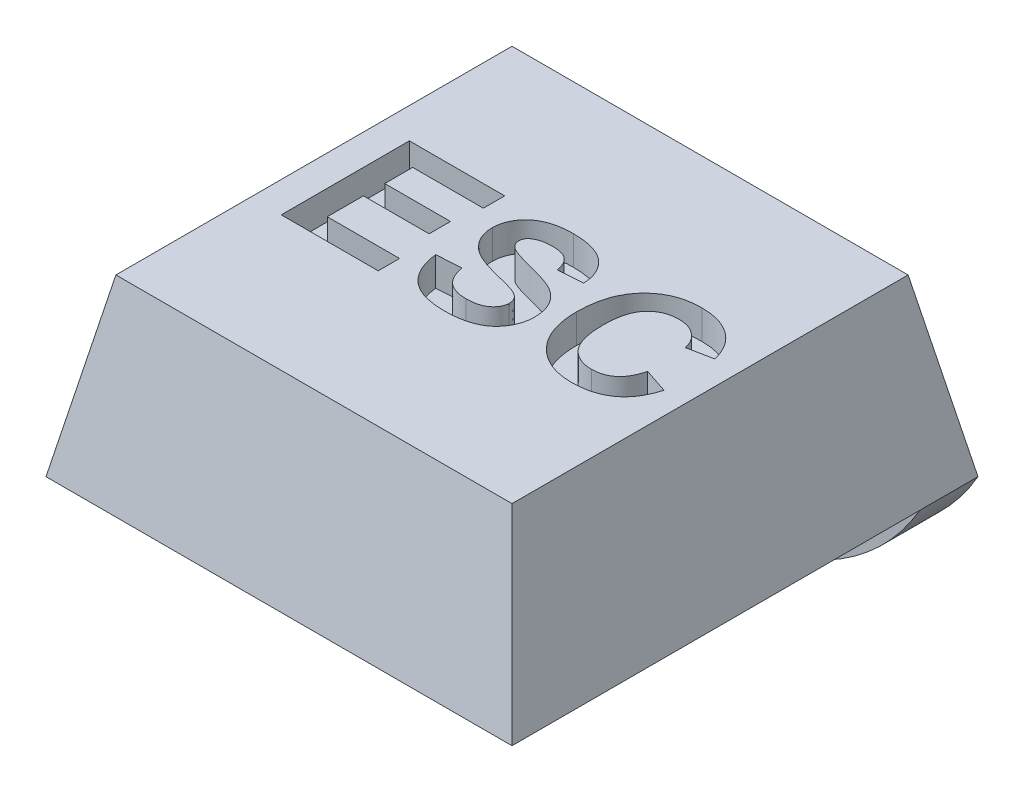
from build123d import *

# Parameters (mm, degrees)
SKETCH1_W               = 8
SKETCH1_H               = 8
BOSS_EXTRUDE1_DEPTH     = 3
CUT_EXTRUDE1_DEPTH      = 12.704699911
CUT_EXTRUDE1_DEPTH_BACK = 12.704699911
CUT_EXTRUDE2_DEPTH      = 11
SKETCH4_R               = 1.75
CUT_EXTRUDE3_DEPTH      = 0.4
SKETCH5_W               = 8
SKETCH5_H               = 1
BOSS_EXTRUDE2_DEPTH     = 2
FILLET1_R               = 4
CUT_EXTRUDE4_DEPTH      = 0.5


with BuildPart() as part:
    # Sketch1 → Boss-Extrude1 (new body)
    with BuildSketch(Plane(origin=(0, 0, 0), x_dir=(1, 0, 0), z_dir=(0, 1, 0))):
        with Locations((4, 4)):
            Rectangle(SKETCH1_W, SKETCH1_H)
    extrude(amount=BOSS_EXTRUDE1_DEPTH)

    # Sketch2 → Cut-Extrude1 (cut, two sides: drawn at the far end of the back side and taken through both)
    with BuildSketch(Plane.XY.offset(-CUT_EXTRUDE1_DEPTH_BACK)):
        Polygon((0, 0), (0.6, 3), (0, 3), align=None)
        Polygon((8, 0), (7.4, 3), (8, 3), align=None)
    extrude(amount=CUT_EXTRUDE1_DEPTH + CUT_EXTRUDE1_DEPTH_BACK, mode=Mode.SUBTRACT)

    # Sketch3 → Cut-Extrude2 (cut)
    with BuildSketch(Plane(origin=(0, 0, 0), x_dir=(0, 0, -1), z_dir=(1, 0, 0))):
        Polygon((0, 0), (0.6, 3), (0, 3), align=None)
        Polygon((8, 3), (7.4, 3), (8, 0), align=None)
    extrude(amount=CUT_EXTRUDE2_DEPTH, mode=Mode.SUBTRACT)

    # Sketch4 → Cut-Extrude3 (cut)
    with BuildSketch(Plane.XZ):
        with Locations(Location((4, -3.75, 0), (0, 0, 270))):
            Circle(SKETCH4_R)
    extrude(amount=-CUT_EXTRUDE3_DEPTH, mode=Mode.SUBTRACT)

    # Sketch5 → Boss-Extrude2 (add)
    with BuildSketch(Plane.XZ):
        with Locations((4, -7.5)):
            Rectangle(SKETCH5_W, SKETCH5_H)
    extrude(amount=BOSS_EXTRUDE2_DEPTH)

    # Fillet1
    # the kernel refuses this fillet: 4 mm, written as the material it takes off along each edge
    with BuildSketch(Plane(origin=(8, -2, -16.660254038), x_dir=(0, 1, 0), z_dir=(0, 0, 1)), Plane(origin=(0, -2, 1.660254038), x_dir=(0, 1, 0), z_dir=(0, 0, -1))) as fillet1_piece_1:
        with BuildLine():
            CenterArc((4, 3.464101615), FILLET1_R, 180, 60)
            Line((0, 3.464101615), (-0.08, 3.464101615))
            Line((-0.08, 3.464101615), (-0.08, 0))
            Line((-0.08, 0), (0, -0.08))
            ThreePointArc((0, -0.08), (1, -0.08), (1.96, -0.069282032))
            Line((1.96, -0.069282032), (2, 0))
        make_face()
    extrude(amount=18.320508076, mode=Mode.SUBTRACT)

    # Sketch6 → Cut-Extrude4 (cut)
    with BuildSketch(Plane(origin=(0, 3, 0), x_dir=(1, 0, 0), z_dir=(0, 1, 0))):
        Polygon((1.125870015, 2.912739384), (1.125870015, 5.112739384), (2.761767451, 5.112739384), (2.761767451, 4.746072718), (1.548946938, 4.746072718), (1.548946938, 4.266585538), (2.677152067, 4.266585538), (2.677152067, 3.899918872), (1.548946938, 3.899918872), (1.548946938, 3.279406051), (2.789972579, 3.279406051), (2.789972579, 2.912739384), align=None)
        with BuildLine():
            Line((3.043818733, 3.646072718), (3.466895656, 3.674277846))
            add(Edge.make_bspline(
                [(3.466895656, 3.674277846), (3.47026619, 3.656577797), (3.476813238, 3.622196579), (3.49135955, 3.573198648), (3.507371013, 3.527518681), (3.526505589, 3.485646517), (3.547453062, 3.446808174), (3.571934275, 3.412110062), (3.598241356, 3.380444359), (3.627676557, 3.352948362), (3.659745827, 3.328866988), (3.694609187, 3.30832959), (3.731888865, 3.290554101), (3.771676011, 3.275916549), (3.814380695, 3.264989545), (3.859630895, 3.25721563), (3.907491509, 3.252237429), (3.940200428, 3.251552081), (3.956959759, 3.251200923)],
                knots=[0, 0, 0, 0, 1.204560339, 2.339781841, 3.415289417, 4.440034832, 5.416475564, 6.362424008, 7.275913008, 8.16578645, 9.05021719, 9.95355393, 10.867835453, 11.809845306, 12.784702352, 13.812224031, 14.87903166, 16, 16, 16, 16], degree=3))
            add(Edge.make_bspline(
                [(3.956959759, 3.251200923), (3.974600015, 3.251393377), (4.008911222, 3.25176771), (4.058631954, 3.256411641), (4.105123098, 3.263064572), (4.147974119, 3.273596006), (4.187985219, 3.285373748), (4.22416269, 3.301486955), (4.257091969, 3.320071209), (4.286688222, 3.341159522), (4.3125169, 3.364547974), (4.335113116, 3.38896476), (4.354792928, 3.413882364), (4.370282333, 3.440406521), (4.3828177, 3.467464485), (4.3911027, 3.49586344), (4.396699709, 3.524951286), (4.397341522, 3.544830846), (4.397664887, 3.554846756)],
                knots=[0, 0, 0, 0, 1.417779877, 2.757654889, 4.012140507, 5.189587551, 6.302846416, 7.360586765, 8.365575446, 9.33904572, 10.275781718, 11.161696098, 12.012180333, 12.822428111, 13.625933072, 14.403138519, 15.195454004, 16, 16, 16, 16], degree=3))
            add(Edge.make_bspline(
                [(4.397664887, 3.554846756), (4.397268308, 3.567395879), (4.396492458, 3.591946401), (4.387152008, 3.627044061), (4.373144499, 3.659561029), (4.35205403, 3.689017029), (4.323703249, 3.71593552), (4.287539002, 3.741117109), (4.242551822, 3.763770691), (4.209177186, 3.776406901), (4.191414887, 3.783132013)],
                knots=[0, 0, 0, 0, 0.90494901, 1.770400303, 2.607161909, 3.452839393, 4.36912122, 5.420987164, 6.627424851, 8, 8, 8, 8], degree=3))
            add(Edge.make_bspline(
                [(4.191414887, 3.783132013), (4.183793555, 3.785685956), (4.166738252, 3.791401267), (4.137643715, 3.799573623), (4.102598573, 3.809778723), (4.061096401, 3.821378449), (4.013151153, 3.833241916), (3.959298316, 3.84785636), (3.898881364, 3.862398927), (3.856613592, 3.873134246), (3.834443733, 3.878765025)],
                knots=[0, 0, 0, 0, 0.521821638, 1.167752076, 1.961721917, 2.891982557, 3.96540661, 5.168436773, 6.514817513, 8, 8, 8, 8], degree=3))
            add(Edge.make_bspline(
                [(3.834443733, 3.878765025), (3.805571998, 3.885973624), (3.749868706, 3.899881436), (3.670423056, 3.924622448), (3.59725216, 3.949204014), (3.531060534, 3.975876331), (3.471118057, 4.002831746), (3.418394318, 4.031962707), (3.371789087, 4.06175634), (3.344631137, 4.084024829), (3.331599182, 4.094710538)],
                knots=[0, 0, 0, 0, 1.293880989, 2.496331788, 3.617634808, 4.64976062, 5.598842568, 6.473791081, 7.267636666, 8, 8, 8, 8], degree=3))
            add(Edge.make_bspline(
                [(3.331599182, 4.094710538), (3.315437863, 4.109842312), (3.283752103, 4.139509552), (3.242042718, 4.188258523), (3.206995477, 4.23975401), (3.178147761, 4.293615909), (3.155935566, 4.3501543), (3.140191847, 4.40899074), (3.13000194, 4.470278784), (3.12896213, 4.512017394), (3.128434118, 4.533212141)],
                knots=[0, 0, 0, 0, 1.064429417, 2.086912298, 3.078678339, 4.055528992, 5.020032834, 5.993708893, 6.981211098, 8, 8, 8, 8], degree=3))
            add(Edge.make_bspline(
                [(3.128434118, 4.533212141), (3.129462426, 4.560637891), (3.131502283, 4.615042392), (3.150209101, 4.695009582), (3.179349212, 4.772171761), (3.213144831, 4.833441389), (3.245615129, 4.879792095), (3.272579348, 4.913052937), (3.302202148, 4.944181887), (3.334889297, 4.972419613), (3.369427042, 4.999420158), (3.407153508, 5.023396966), (3.446999034, 5.045981793), (3.50466005, 5.072755055), (3.582947888, 5.100655423), (3.684804571, 5.124173662), (3.79570633, 5.138311162), (3.87259486, 5.140045534), (3.912448541, 5.140944513)],
                knots=[0, 0, 0, 0, 1.180131776, 2.341029169, 3.518901375, 4.725685298, 5.343762192, 5.955650671, 6.568945152, 7.192346361, 7.815201106, 8.455999361, 9.116257477, 9.787318263, 11.192748436, 12.688084276, 14.283332633, 16, 16, 16, 16], degree=3))
            add(Edge.make_bspline(
                [(3.912448541, 5.140944513), (3.945080768, 5.140508138), (4.008549753, 5.139659398), (4.100555419, 5.13107681), (4.186493702, 5.117719026), (4.266063037, 5.098543989), (4.339300495, 5.073208732), (4.406489968, 5.043029652), (4.467574359, 5.00719951), (4.521810028, 4.965512691), (4.570128811, 4.919555646), (4.612279221, 4.869357216), (4.648422408, 4.815551374), (4.678791636, 4.758177443), (4.702640511, 4.696940436), (4.720156568, 4.631916765), (4.73174184, 4.563259479), (4.734645724, 4.516214821), (4.736126426, 4.492226564)],
                knots=[0, 0, 0, 0, 1.325124071, 2.577337985, 3.749592149, 4.855247722, 5.896868755, 6.892903601, 7.842551483, 8.766257401, 9.665194363, 10.546067736, 11.423174165, 12.293291263, 13.177512979, 14.086532529, 15.024315359, 16, 16, 16, 16], degree=3))
            Line((4.736126426, 4.492226564), (4.313049502, 4.464021436))
            add(Edge.make_bspline(
                [(4.313049502, 4.464021436), (4.310608879, 4.477287993), (4.305852356, 4.503143134), (4.295510374, 4.540172949), (4.283845121, 4.574421305), (4.270191546, 4.60588798), (4.253699677, 4.634009379), (4.235751784, 4.659670214), (4.215852767, 4.682528569), (4.193343761, 4.701958509), (4.168998272, 4.719638959), (4.141252995, 4.733810248), (4.111270487, 4.746958085), (4.077910097, 4.756842035), (4.041812463, 4.764682339), (4.00295656, 4.77049463), (3.961261846, 4.773332518), (3.932577419, 4.773955523), (3.917737002, 4.774277846)],
                knots=[0, 0, 0, 0, 1.151066407, 2.24330871, 3.278475654, 4.238599069, 5.165719782, 6.056502506, 6.909492653, 7.744782051, 8.590364415, 9.471203867, 10.39832458, 11.382154319, 12.435022857, 13.550631277, 14.73277401, 16, 16, 16, 16], degree=3))
            add(Edge.make_bspline(
                [(3.917737002, 4.774277846), (3.902307022, 4.773993288), (3.872287307, 4.773439667), (3.82854058, 4.770042179), (3.787502868, 4.763770743), (3.748972622, 4.755606889), (3.713001312, 4.74450053), (3.679664846, 4.730958145), (3.648810708, 4.715014589), (3.6299972, 4.702470749), (3.620701746, 4.696273038)],
                knots=[0, 0, 0, 0, 1.186678824, 2.308736671, 3.37120409, 4.377216403, 5.334874112, 6.262130804, 7.141346615, 8, 8, 8, 8], degree=3))
            add(Edge.make_bspline(
                [(3.620701746, 4.696273038), (3.61006388, 4.687806789), (3.589461635, 4.671410293), (3.567289261, 4.638852427), (3.55394144, 4.602079293), (3.552334878, 4.576074512), (3.551511041, 4.562739384)],
                knots=[0, 0, 0, 0, 1.037857257, 2.010007357, 2.979541333, 4, 4, 4, 4], degree=3))
            add(Edge.make_bspline(
                [(3.551511041, 4.562739384), (3.55218479, 4.550276823), (3.553511967, 4.52572756), (3.56689826, 4.4908548), (3.587484556, 4.45854268), (3.606719073, 4.440990313), (3.6167354, 4.431849961)],
                knots=[0, 0, 0, 0, 0.98538058, 1.941042925, 2.927803204, 4, 4, 4, 4], degree=3))
            add(Edge.make_bspline(
                [(3.6167354, 4.431849961), (3.624684646, 4.425917415), (3.642447902, 4.412660642), (3.674986667, 4.395810029), (3.714261809, 4.377559798), (3.761168708, 4.359718182), (3.815395621, 4.341909685), (3.876945847, 4.323315555), (3.94585724, 4.304471782), (4.020373284, 4.28622251), (4.096028056, 4.268284525), (4.16822332, 4.248673243), (4.235354533, 4.229553761), (4.297110428, 4.209513441), (4.353809344, 4.190004251), (4.405175858, 4.169966908), (4.451562673, 4.150452778), (4.505654841, 4.123619468), (4.566962873, 4.087272664), (4.631220607, 4.034436522), (4.688048373, 3.975045249), (4.727644451, 3.919043375), (4.754844884, 3.870880273), (4.772359092, 3.832488672), (4.787510257, 3.792033606), (4.799843264, 3.749470368), (4.808781726, 3.704739066), (4.816178824, 3.658181449), (4.819958138, 3.609410844), (4.820477775, 3.576152762), (4.82074181, 3.559253808)],
                knots=[0, 0, 0, 0, 0.511875881, 1.143829537, 1.88775736, 2.750598373, 3.734912702, 4.837306479, 6.073130119, 7.42648979, 8.801963576, 10.091065733, 11.292408984, 12.408830014, 13.446061236, 14.39066453, 15.257936293, 16.045629259, 17.510392066, 18.929669597, 20.331293837, 21.746891395, 22.460690638, 23.187651344, 23.925159671, 24.69163991, 25.474819891, 26.281170188, 27.126635539, 28, 28, 28, 28], degree=3))
            add(Edge.make_bspline(
                [(4.82074181, 3.559253808), (4.820378753, 3.543669193), (4.819657756, 3.512719659), (4.814619235, 3.466782737), (4.806827289, 3.42166157), (4.795292532, 3.377299593), (4.7799905, 3.333784076), (4.762761628, 3.290486968), (4.741217893, 3.248352489), (4.716698184, 3.207345741), (4.689651831, 3.167497498), (4.65900329, 3.130738401), (4.626552736, 3.095842079), (4.590226664, 3.06476253), (4.552268292, 3.034983227), (4.510941443, 3.008610176), (4.467214345, 2.984744899), (4.420810518, 2.963565576), (4.371565435, 2.94510971), (4.319543056, 2.928682706), (4.264274691, 2.915238465), (4.206221198, 2.903715057), (4.145170128, 2.894951803), (4.081197808, 2.888833014), (4.014289695, 2.885382386), (3.968715741, 2.884820479), (3.945501426, 2.884534256)],
                knots=[0, 0, 0, 0, 0.900570041, 1.788444861, 2.667795364, 3.545012114, 4.433698372, 5.332345486, 6.235991676, 7.164928091, 8.092777575, 9.015680987, 9.928493428, 10.842962589, 11.775229507, 12.714851019, 13.672254427, 14.652424454, 15.660007982, 16.709910502, 17.803296389, 18.945495772, 20.129342395, 21.366102753, 22.658353839, 24, 24, 24, 24], degree=3))
            add(Edge.make_bspline(
                [(3.945501426, 2.884534256), (3.911983536, 2.885081493), (3.846723411, 2.886146975), (3.75191217, 2.895683882), (3.662985503, 2.910280806), (3.580088175, 2.931465866), (3.503118865, 2.958662702), (3.432112679, 2.992163198), (3.367413065, 3.032167502), (3.308218685, 3.077705443), (3.255318209, 3.129606836), (3.207749995, 3.186796305), (3.166155751, 3.249788831), (3.130562817, 3.318485884), (3.100071341, 3.392516091), (3.074924727, 3.471913444), (3.055990649, 3.557056626), (3.04794621, 3.61588751), (3.043818733, 3.646072718)],
                knots=[0, 0, 0, 0, 1.217954099, 2.371385517, 3.459848295, 4.490682126, 5.476952527, 6.422732854, 7.338496285, 8.236688651, 9.131557988, 10.026443255, 10.935708282, 11.869506048, 12.834296687, 13.842423496, 14.892981177, 16, 16, 16, 16], degree=3))
        make_face()
        with BuildLine():
            Line((6.597664887, 3.730688102), (7.02074181, 3.589662461))
            add(Edge.make_bspline(
                [(7.02074181, 3.589662461), (7.012143585, 3.561922373), (6.995305555, 3.507598554), (6.964388109, 3.429739623), (6.92903449, 3.357584202), (6.890516091, 3.290287759), (6.846437529, 3.22958878), (6.799266556, 3.173477559), (6.747600591, 3.123135903), (6.691694568, 3.078456317), (6.632086614, 3.038945186), (6.568084319, 3.005542852), (6.500642826, 2.976774288), (6.429078241, 2.953465685), (6.353865514, 2.934799032), (6.274651743, 2.922469607), (6.191807481, 2.914109849), (6.135240228, 2.913203448), (6.106278669, 2.912739384)],
                knots=[0, 0, 0, 0, 1.126640671, 2.206316847, 3.246446654, 4.24268115, 5.210795778, 6.153057602, 7.084219323, 8.004711971, 8.926421631, 9.854560063, 10.802134612, 11.768317461, 12.772025444, 13.805668576, 14.876536225, 16, 16, 16, 16], degree=3))
            add(Edge.make_bspline(
                [(6.106278669, 2.912739384), (6.070531543, 2.913478557), (6.000215876, 2.914932533), (5.897385873, 2.929568804), (5.799393529, 2.952404876), (5.706098662, 2.984021022), (5.618124, 3.025896526), (5.534666915, 3.076309204), (5.456334777, 3.136282516), (5.38340239, 3.204805679), (5.317141552, 3.281355594), (5.259843069, 3.365518608), (5.210883497, 3.456109066), (5.171311847, 3.553558916), (5.140369486, 3.657768094), (5.118694298, 3.768592513), (5.105131344, 3.886067083), (5.103586128, 3.966573938), (5.102793092, 4.007891628)],
                knots=[0, 0, 0, 0, 1.025049111, 2.016302254, 2.973197159, 3.90886983, 4.83646737, 5.763135642, 6.70136783, 7.661478232, 8.629732022, 9.600038443, 10.576877021, 11.5787097, 12.612181225, 13.690866959, 14.814907849, 16, 16, 16, 16], degree=3))
            add(Edge.make_bspline(
                [(5.102793092, 4.007891628), (5.103582553, 4.051412265), (5.105122647, 4.136313086), (5.11871101, 4.259751611), (5.139806133, 4.376085226), (5.170800791, 4.484592614), (5.20979093, 4.586037414), (5.258809944, 4.67941259), (5.315536876, 4.76596309), (5.38149699, 4.844102549), (5.454761758, 4.913479822), (5.533274019, 4.974828087), (5.617766221, 5.026294883), (5.707776005, 5.068381736), (5.803424088, 5.100950614), (5.904522262, 5.124402762), (6.011153243, 5.138053421), (6.084057374, 5.139967631), (6.121262644, 5.140944513)],
                knots=[0, 0, 0, 0, 1.212648312, 2.365655595, 3.457000981, 4.504219827, 5.506356588, 6.480637568, 7.437950897, 8.385265166, 9.323599949, 10.245787653, 11.157260172, 12.074946661, 13.00980897, 13.968233668, 14.963125779, 16, 16, 16, 16], degree=3))
            add(Edge.make_bspline(
                [(6.121262644, 5.140944513), (6.153755443, 5.140125778), (6.217461901, 5.138520541), (6.310753539, 5.127614498), (6.399167904, 5.108475121), (6.483182904, 5.082641218), (6.56232028, 5.048547339), (6.636721807, 5.006884969), (6.706643219, 4.957874546), (6.748772309, 4.919591601), (6.769980592, 4.900319513)],
                knots=[0, 0, 0, 0, 1.098510076, 2.153775193, 3.169777012, 4.153122333, 5.120892526, 6.076995459, 7.031936742, 8, 8, 8, 8], degree=3))
            add(Edge.make_bspline(
                [(6.769980592, 4.900319513), (6.782272635, 4.888056487), (6.807145451, 4.863242387), (6.840357641, 4.821349155), (6.871846924, 4.776251084), (6.901113501, 4.727178857), (6.927232384, 4.673761637), (6.951460438, 4.616819742), (6.973766298, 4.556133679), (6.986170922, 4.513899928), (6.992536682, 4.492226564)],
                knots=[0, 0, 0, 0, 0.885292881, 1.791380647, 2.722937556, 3.69093542, 4.703306561, 5.754477758, 6.847650944, 8, 8, 8, 8], degree=3))
            Line((6.992536682, 4.492226564), (6.569459759, 4.407611179))
            add(Edge.make_bspline(
                [(6.569459759, 4.407611179), (6.565863779, 4.421488127), (6.558780642, 4.448822073), (6.544448878, 4.488099452), (6.528009215, 4.525370177), (6.507633758, 4.559721358), (6.485989754, 4.592681181), (6.460364474, 4.622786129), (6.43239444, 4.650825186), (6.401878159, 4.676507375), (6.369179429, 4.699313747), (6.334927817, 4.719815256), (6.298500785, 4.736550893), (6.260382903, 4.750089984), (6.22072599, 4.761441491), (6.17917698, 4.768453847), (6.136092729, 4.773837069), (6.106737903, 4.774128767), (6.0917354, 4.774277846)],
                knots=[0, 0, 0, 0, 1.051226935, 2.070641259, 3.064374968, 4.034983734, 4.997599858, 5.953980297, 6.92954377, 7.901109626, 8.875958313, 9.851998019, 10.826131395, 11.811470594, 12.818270757, 13.847890818, 14.900111925, 16, 16, 16, 16], degree=3))
            add(Edge.make_bspline(
                [(6.0917354, 4.774277846), (6.071132245, 4.773861756), (6.030921051, 4.773049673), (5.97214623, 4.763995499), (5.916127146, 4.751359463), (5.863089719, 4.7320643), (5.813362398, 4.707385946), (5.766380029, 4.677386648), (5.722400475, 4.642194899), (5.681408872, 4.601393793), (5.64462448, 4.554245626), (5.612285749, 4.500653055), (5.585457873, 4.44000763), (5.563677904, 4.372904473), (5.546534587, 4.299184012), (5.534292909, 4.218751698), (5.527522893, 4.131552506), (5.526432863, 4.071217641), (5.525870015, 4.040063102)],
                knots=[0, 0, 0, 0, 0.938194206, 1.831074359, 2.704771284, 3.551924377, 4.396294915, 5.230222094, 6.087631332, 6.958733431, 7.860107878, 8.806247581, 9.804197948, 10.875520245, 12.017191412, 13.250061517, 14.580040491, 16, 16, 16, 16], degree=3))
            add(Edge.make_bspline(
                [(5.525870015, 4.040063102), (5.526427321, 4.006999524), (5.527501164, 3.943291101), (5.534269743, 3.851397593), (5.546589701, 3.766879877), (5.563505184, 3.689587962), (5.58539491, 3.61956919), (5.612177418, 3.556944728), (5.644016708, 3.501641236), (5.680863246, 3.45369554), (5.721785488, 3.412510334), (5.765675085, 3.377100434), (5.812273099, 3.346825109), (5.861859936, 3.321916524), (5.914624196, 3.303073456), (5.970132236, 3.289408133), (6.028587723, 3.28072087), (6.068640693, 3.279850467), (6.089091169, 3.279406051)],
                knots=[0, 0, 0, 0, 1.475208372, 2.842499301, 4.107722225, 5.282836115, 6.369007568, 7.375918121, 8.315702116, 9.208439171, 10.065831443, 10.90006451, 11.71996243, 12.54067204, 13.369972975, 14.214060185, 15.088124569, 16, 16, 16, 16], degree=3))
            add(Edge.make_bspline(
                [(6.089091169, 3.279406051), (6.104231956, 3.27978379), (6.134004064, 3.280526557), (6.178009536, 3.285240842), (6.220245815, 3.294237377), (6.260919633, 3.306133666), (6.300189022, 3.321059998), (6.337454994, 3.340207482), (6.373450743, 3.362214671), (6.407429383, 3.38800541), (6.439845908, 3.416960438), (6.469411701, 3.450425235), (6.49683643, 3.487595716), (6.521772168, 3.528720293), (6.5450521, 3.573446955), (6.564858784, 3.622472566), (6.583310486, 3.67500485), (6.592796514, 3.711802825), (6.597664887, 3.730688102)],
                knots=[0, 0, 0, 0, 0.980177776, 1.927374078, 2.859849964, 3.771585772, 4.668674471, 5.574490016, 6.479656464, 7.396337719, 8.332153134, 9.288470092, 10.28125149, 11.318486971, 12.398724812, 13.541284404, 14.738150009, 16, 16, 16, 16], degree=3))
        make_face()
    extrude(amount=-CUT_EXTRUDE4_DEPTH, mode=Mode.SUBTRACT)


solid = part.part
